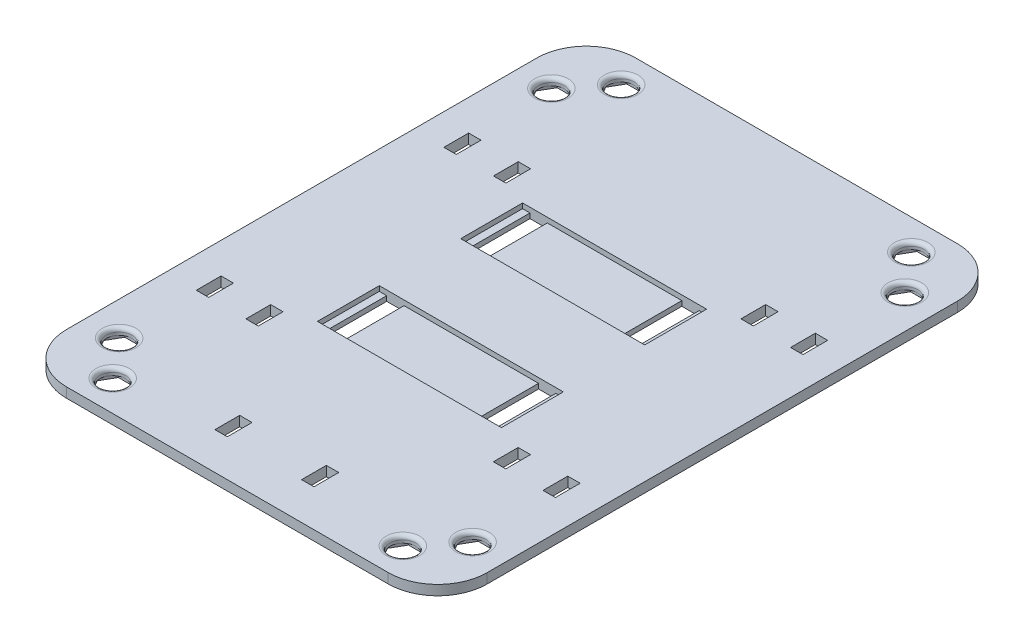
from build123d import *

# Parameters (mm, degrees)
SKETCH1_W           = 107.95
SKETCH1_H           = 146.05
BOSS_EXTRUDE1_DEPTH = 2.54
SKETCH2_R           = 3.302
CUT_EXTRUDE1_DEPTH  = 91.842736914
SKETCH3_W           = 4.445
SKETCH3_H           = 15.875
CUT_EXTRUDE2_DEPTH  = 91.842736914
FILLET1_R           = 12.7
SKETCH11_W          = 47.200058
SKETCH11_H          = 15.875
CUT_EXTRUDE9_DEPTH  = 1.27
FILLET2_R           = 1.016
SKETCH14_W          = 3.175
SKETCH14_H          = 6.35
CUT_EXTRUDE14_DEPTH = 91.842736914
CUT_EXTRUDE15_DEPTH = 0.79375


with BuildPart() as part:
    # Sketch1 → Boss-Extrude1 (new body)
    with BuildSketch(Plane(origin=(0, 0, 0), x_dir=(1, 0, 0), z_dir=(0, 1, 0))):
        Rectangle(SKETCH1_W, SKETCH1_H)
    extrude(amount=-BOSS_EXTRUDE1_DEPTH)

    # Sketch2 → Cut-Extrude1 (cut, through all)
    with BuildSketch(Plane(origin=(0, 0, 0), x_dir=(1, 0, 0), z_dir=(0, 1, 0))):
        with Locations((-37.218937681, 65.210784985)):
            Circle(SKETCH2_R)
        with Locations((45.326413441, 55.435363088)):
            Circle(SKETCH2_R)
        with Locations((37.218937681, 65.210784985)):
            Circle(SKETCH2_R)
        with Locations((-45.326413441, -55.435363088)):
            Circle(SKETCH2_R)
        with Locations((-45.326413441, 55.435363088)):
            Circle(SKETCH2_R)
        with Locations((-37.218937681, -65.210784985)):
            Circle(SKETCH2_R)
        with Locations((37.218937681, -65.210784985)):
            Circle(SKETCH2_R)
        with Locations((45.326413441, -55.435363088)):
            Circle(SKETCH2_R)
    extrude(amount=-CUT_EXTRUDE1_DEPTH, mode=Mode.SUBTRACT)

    # Sketch3 → Cut-Extrude2 (cut, through all)
    with BuildSketch(Plane(origin=(0, 0, 0), x_dir=(1, 0, 0), z_dir=(0, 1, 0))):
        with Locations((-19.472529, 18.374995)):
            Rectangle(SKETCH3_W, SKETCH3_H)
        with Locations((19.472529, 18.374995)):
            Rectangle(SKETCH3_W, SKETCH3_H)
        with Locations((19.472529, -18.374995)):
            Rectangle(SKETCH3_W, SKETCH3_H)
        with Locations((-19.472529, -18.374995)):
            Rectangle(SKETCH3_W, SKETCH3_H)
    extrude(amount=-CUT_EXTRUDE2_DEPTH, mode=Mode.SUBTRACT)

    # Fillet1
    fillet1_edges = [part.edges().sort_by_distance(p)[0] for p in [
        (53.975, -1.27, -73.025),
        (53.975, -1.27, 73.025),
        (-53.975, -1.27, 73.025),
        (-53.975, -1.27, -73.025),
    ]]
    fillet(fillet1_edges, radius=FILLET1_R)

    # Sketch11 → Cut-Extrude9 (cut, symmetric)
    with BuildSketch(Plane(origin=(0, 0, 0), x_dir=(1, 0, 0), z_dir=(0, 1, 0))):
        with Locations((0, -18.374995)):
            Rectangle(SKETCH11_W, SKETCH11_H)
        with Locations((0, 18.374995)):
            Rectangle(SKETCH11_W, SKETCH11_H)
    extrude(amount=CUT_EXTRUDE9_DEPTH, both=True, mode=Mode.SUBTRACT)

    # Fillet2
    fillet2_edges = [part.edges().sort_by_distance(p)[0] for p in [
        (-40.520937681, 0, -65.210784985),
        (33.916937681, 0, 65.210784985),
        (42.024413441, 0, 55.435363088),
        (-40.520937681, 0, 65.210784985),
        (-48.628413441, 0, 55.435363088),
        (42.024413441, 0, -55.435363088),
        (33.916937681, 0, -65.210784985),
        (-48.628413441, 0, -55.435363088),
    ]]
    fillet(fillet2_edges, radius=FILLET2_R)

    # Sketch14 → Cut-Extrude14 (cut, through all)
    with BuildSketch(Plane(origin=(0, 0, 0), x_dir=(1, 0, 0), z_dir=(0, 1, 0))):
        with Locations((31.7373, -31.75)):
            Rectangle(SKETCH14_W, SKETCH14_H)
        with Locations((-31.7373, -31.75)):
            Rectangle(SKETCH14_W, SKETCH14_H)
        with Locations((-31.7373, 31.75)):
            Rectangle(SKETCH14_W, SKETCH14_H)
        with Locations((31.7373, 31.75)):
            Rectangle(SKETCH14_W, SKETCH14_H)
        with Locations((-11.1125, -60.325)):
            Rectangle(SKETCH14_W, SKETCH14_H)
        with Locations((11.1125, -60.325)):
            Rectangle(SKETCH14_W, SKETCH14_H)
        with Locations((44.4627, 31.75)):
            Rectangle(SKETCH14_W, SKETCH14_H)
        with Locations((44.4627, -31.75)):
            Rectangle(SKETCH14_W, SKETCH14_H)
        with Locations((-44.4627, 31.75)):
            Rectangle(SKETCH14_W, SKETCH14_H)
        with Locations((-44.4627, -31.75)):
            Rectangle(SKETCH14_W, SKETCH14_H)
    extrude(amount=-CUT_EXTRUDE14_DEPTH, mode=Mode.SUBTRACT)

    # Sketch17 → Cut-Extrude15 (cut)
    with BuildSketch(Plane.XZ.offset(2.54)):
        Polygon((43.346679368, -52.006363088), (47.306147514, -52.006363088), (49.285881587, -55.435363088), (47.306147514, -58.864363088), (43.346679368, -58.864363088), (41.366945295, -55.435363088), align=None)
        Polygon((-41.366945295, -55.435363088), (-43.346679368, -52.006363088), (-47.306147514, -52.006363088), (-49.285881587, -55.435363088), (-47.306147514, -58.864363088), (-43.346679368, -58.864363088), align=None)
        Polygon((-33.259469535, -65.210784985), (-35.239203608, -61.781784985), (-39.198671754, -61.781784985), (-41.178405827, -65.210784985), (-39.198671754, -68.639784985), (-35.239203608, -68.639784985), align=None)
        Polygon((35.239203608, -61.781784985), (39.198671754, -61.781784985), (41.178405827, -65.210784985), (39.198671754, -68.639784985), (35.239203608, -68.639784985), (33.259469535, -65.210784985), align=None)
        Polygon((-41.366945295, 55.435363088), (-43.346679368, 52.006363088), (-47.306147514, 52.006363088), (-49.285881587, 55.435363088), (-47.306147514, 58.864363088), (-43.346679368, 58.864363088), align=None)
        Polygon((-33.259469535, 65.210784985), (-35.239203608, 61.781784985), (-39.198671754, 61.781784985), (-41.178405827, 65.210784985), (-39.198671754, 68.639784985), (-35.239203608, 68.639784985), align=None)
        Polygon((39.198671754, 68.639784985), (35.239203608, 68.639784985), (33.259469535, 65.210784985), (35.239203608, 61.781784985), (39.198671754, 61.781784985), (41.178405827, 65.210784985), align=None)
        Polygon((47.306147514, 58.864363088), (43.346679368, 58.864363088), (41.366945295, 55.435363088), (43.346679368, 52.006363088), (47.306147514, 52.006363088), (49.285881587, 55.435363088), align=None)
    extrude(amount=-CUT_EXTRUDE15_DEPTH, mode=Mode.SUBTRACT)


solid = part.part
